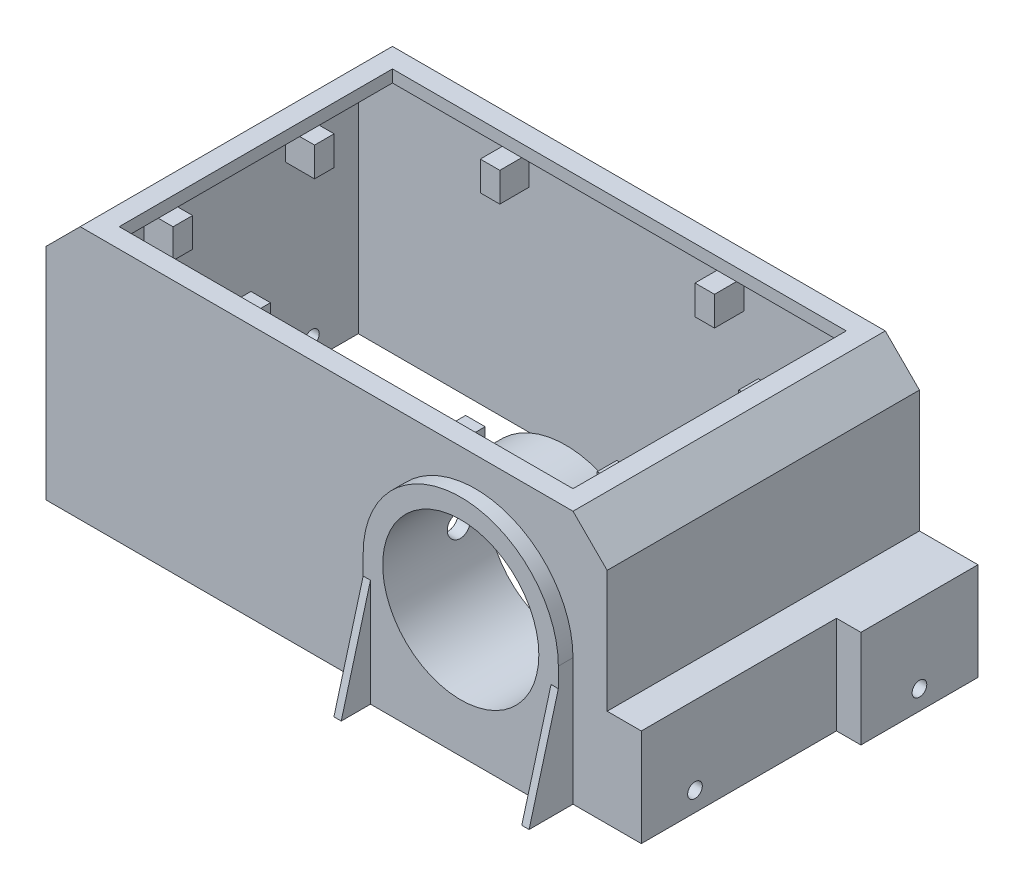
from build123d import *

# Parameters (mm, degrees)
CROQUIS1_W              = 127
CROQUIS1_H              = 64
SALIENTE_EXTRUIR1_DEPTH = 52
CORTAR_EXTRUIR1_DEPTH   = 105.078095678
CORTAR_EXTRUIR2_DEPTH   = 105.078095678
CROQUIS4_W              = 5
CROQUIS4_H              = 20
CORTAR_EXTRUIR3_DEPTH   = 40
SALIENTE_EXTRUIR2_DEPTH = 26
VACIADO1_START          = -29.5
VACIADO1_DEPTH          = 59
VACIADO1_START_2        = 29.5
VACIADO1_2_OUTLINE_W    = 35
VACIADO1_2_OUTLINE_H    = 23.5
VACIADO1_2_DEPTH        = 3
VACIADO1_3_OUTLINE_W    = 5
VACIADO1_3_OUTLINE_H    = 17.5
VACIADO1_3_DEPTH        = 19
CORTAR_EXTRUIR4_DEPTH   = 127.684647847
SALIENTE_EXTRUIR3_DEPTH = 3
CROQUIS8_R              = 16
CORTAR_EXTRUIR5_DEPTH   = 10
CROQUIS9_R              = 18.5
CROQUIS9_R_2            = 16
SALIENTE_EXTRUIR4_DEPTH = 19
CROQUIS11_R             = 2.42
CORTAR_EXTRUIR6_DEPTH   = 39
CROQUIS12_W             = 93.002602727
CROQUIS12_H             = 56
CORTAR_EXTRUIR8_DEPTH   = 5
CROQUIS13_W             = 4
CROQUIS13_H             = 6
CROQUIS13_W_2           = 6
CROQUIS13_H_2           = 4
SALIENTE_EXTRUIR5_DEPTH = 6
CROQUIS14_R             = 1.5
CORTAR_EXTRUIR9_DEPTH   = 144.227092409


# Read off the part's stored shape, not the designer's step: Vaciado1
with BuildPart() as part:
    # Croquis1 → Saliente-Extruir1 (new body)
    with BuildSketch(Plane(origin=(0, 0, 0), x_dir=(1, 0, 0), z_dir=(0, 1, 0))):
        Rectangle(CROQUIS1_W, CROQUIS1_H)
    extrude(amount=SALIENTE_EXTRUIR1_DEPTH)

    # Croquis2 → Cortar-Extruir1 (cut, through all)
    with BuildSketch(Plane.XY.offset(32)):
        Polygon((-63.5, 52), (-63.5, 45), (-56.500349973, 51.999650027), align=None)
        Polygon((51.5, 20), (63.5, 20), (63.5, 52), (44.500349973, 51.999650027), (51.5, 45), align=None)
    extrude(amount=-CORTAR_EXTRUIR1_DEPTH, mode=Mode.SUBTRACT)

    # Croquis3 → Cortar-Extruir2 (cut, through all)
    with BuildSketch(Plane.XY.offset(32)):
        Polygon((-56.500349973, 51.999650027), (-56.487592612, 52.42007755), (-63.863183818, 52.643880882), (-63.863183818, 51.396655122), (-58.40187656, 51.777539568), align=None)
        Polygon((44.500349973, 51.999650027), (64.754794762, 55.7043164), (64.754794762, 48.499825013), align=None)
    extrude(amount=-CORTAR_EXTRUIR2_DEPTH, mode=Mode.SUBTRACT)

    # Croquis4 → Cortar-Extruir3 (cut)
    with BuildSketch(Plane.XY.offset(32)):
        with Locations((61, 10)):
            Rectangle(CROQUIS4_W, CROQUIS4_H)
    extrude(amount=-CORTAR_EXTRUIR3_DEPTH, mode=Mode.SUBTRACT)

    # Croquis5 → Saliente-Extruir2 (add)
    with BuildSketch(Plane.XZ):
        Polygon((44.5, 32), (44.5, 41), (43, 41), (43, 35), (6, 35), (6, 41), (4.5, 41), (4.5, 32), align=None)
    extrude(amount=-SALIENTE_EXTRUIR2_DEPTH)

    # Vaciado1 outline → Vaciado1 (cut)
    with BuildSketch(Plane.XY.offset(VACIADO1_START)):
        Polygon((56, 0), (56, 17.5), (49, 17.5), (49, 43.964466094), (43.464466094, 49.5), (-55.464466094, 49.5), (-61, 43.964466094), (-61, 0), align=None)
    extrude(amount=VACIADO1_DEPTH, mode=Mode.SUBTRACT)

    # Vaciado1 2 outline → Vaciado1 2 (cut)
    with BuildSketch(Plane.XY.offset(VACIADO1_START_2)):
        with Locations((24.5, 11.75)):
            Rectangle(VACIADO1_2_OUTLINE_W, VACIADO1_2_OUTLINE_H)
    extrude(amount=VACIADO1_2_DEPTH, mode=Mode.SUBTRACT)

    # Vaciado1 3 outline → Vaciado1 3 (cut)
    with BuildSketch(Plane.XY.offset(VACIADO1_START)):
        with Locations((58.5, 8.75)):
            Rectangle(VACIADO1_3_OUTLINE_W, VACIADO1_3_OUTLINE_H)
    extrude(amount=VACIADO1_3_DEPTH, mode=Mode.SUBTRACT)

    # Croquis6 → Cortar-Extruir4 (cut, through all)
    with BuildSketch(Plane(origin=(44.5, 0, 0), x_dir=(0, 0, -1), z_dir=(1, 0, 0))):
        Polygon((-41, 0), (-35, 22), (-35, 26), (-41, 26), align=None)
    extrude(amount=-CORTAR_EXTRUIR4_DEPTH, mode=Mode.SUBTRACT)

    # Croquis7 → Saliente-Extruir3 (add)
    with BuildSketch(Plane.XY.offset(32)):
        with BuildLine():
            Line((4.5, 26), (44.5, 26))
            ThreePointArc((44.5, 26), (24.5, 46), (4.5, 26))
        make_face()
    extrude(amount=SALIENTE_EXTRUIR3_DEPTH)

    # Croquis8 → Cortar-Extruir5 (cut)
    with BuildSketch(Plane.XY.offset(35)):
        with Locations((24.5, 26)):
            Circle(CROQUIS8_R)
    extrude(amount=-CORTAR_EXTRUIR5_DEPTH, mode=Mode.SUBTRACT)

    # Croquis9 → Saliente-Extruir4 (add)
    with BuildSketch(Plane(origin=(0, 0, 32.5), x_dir=(-1, 0, 0), z_dir=(0, 0, -1))):
        with Locations(Location((-24.5, 26, 0), (0, 0, 198.924644416))):
            Circle(CROQUIS9_R)
        with Locations(Location((-24.5, 26, 0), (0, 0, 180))):
            Circle(CROQUIS9_R_2, mode=Mode.SUBTRACT)
    extrude(amount=SALIENTE_EXTRUIR4_DEPTH)

    # Croquis11 → Cortar-Extruir6 (cut)
    with BuildSketch(Plane(origin=(6, 0, 0), x_dir=(0, 0, -1), z_dir=(1, 0, 0))):
        with Locations(Location((-19.360313857, 25.408506724, 0), (0, 0, 180))):
            Circle(CROQUIS11_R)
    extrude(amount=CORTAR_EXTRUIR6_DEPTH, mode=Mode.SUBTRACT)

    # Croquis12 → Cortar-Extruir8 (cut)
    with BuildSketch(Plane(origin=(0, 52, 0), x_dir=(1, 0, 0), z_dir=(0, 1, 0))):
        with Locations((-5.99903799, 0)):
            Rectangle(CROQUIS12_W, CROQUIS12_H)
    extrude(amount=-CORTAR_EXTRUIR8_DEPTH, mode=Mode.SUBTRACT)

    # Croquis13 → Saliente-Extruir5 (add)
    with BuildSketch(Plane.XZ.offset(-49.5)):
        with Locations((-27.999466094, 26.5)):
            Rectangle(CROQUIS13_W, CROQUIS13_H)
        with Locations((16.000533906, 26.5)):
            Rectangle(CROQUIS13_W, CROQUIS13_H)
        with Locations((16.000533906, -26.5)):
            Rectangle(CROQUIS13_W, CROQUIS13_H)
        with Locations((-27.999466094, -26.5)):
            Rectangle(CROQUIS13_W, CROQUIS13_H)
        with Locations((-52.464466094, 18)):
            Rectangle(CROQUIS13_W_2, CROQUIS13_H_2)
        with Locations((40.464466094, 18)):
            Rectangle(CROQUIS13_W_2, CROQUIS13_H_2)
        with Locations((40.464466094, -11)):
            Rectangle(CROQUIS13_W_2, CROQUIS13_H_2)
        with Locations((-52.464466094, -11)):
            Rectangle(CROQUIS13_W_2, CROQUIS13_H_2)
    extrude(amount=SALIENTE_EXTRUIR5_DEPTH)

    # Croquis14 → Cortar-Extruir9 (cut, through all)
    with BuildSketch(Plane.ZY.offset(63.5)):
        with Locations((-20, 4)):
            Circle(CROQUIS14_R)
        with Locations((21, 4)):
            Circle(CROQUIS14_R)
    extrude(amount=-CORTAR_EXTRUIR9_DEPTH, mode=Mode.SUBTRACT)


solid = part.part
